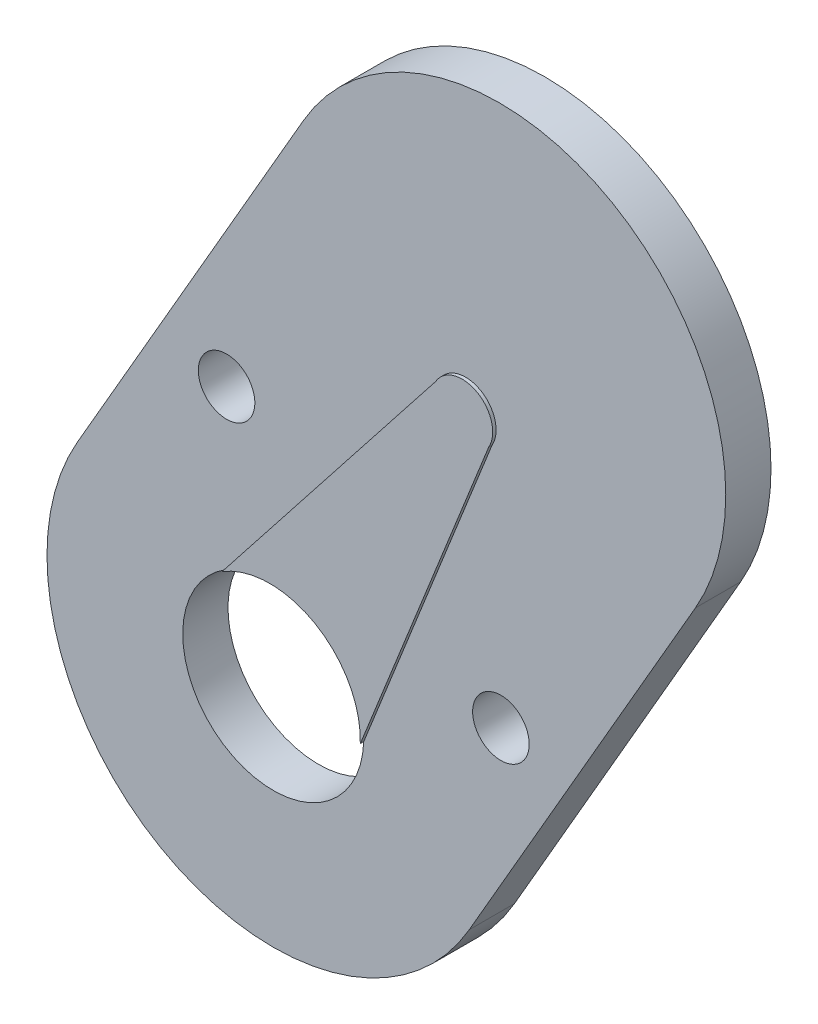
from build123d import *

# Parameters (mm, degrees)
RETAINER_PLATE_2MM_START         = -2
RETAINER_PLATE_2MM_DEPTH         = 2
RETAINER_PLATE_2MM_ROOT_START    = -2
SKETCH_2_R                       = 10
RETAINER_PLATE_2MM_ROOT_DEPTH    = 2
RETAINER_PLATE_2MM_TIP_START     = -2
SKETCH_3_R                       = 10
RETAINER_PLATE_2MM_TIP_DEPTH     = 2
HORN_CONTACT_PAD_0P15_DEPTH      = 0.15
SKETCH_5_R                       = 3.8
HORN_CONTACT_PAD_0P15_ROOT_DEPTH = 0.15
SKETCH_6_R                       = 1.35
HORN_CONTACT_PAD_0P15_TIP_DEPTH  = 0.15
BOSS_CLEARANCE_8_START           = -2.1
SKETCH_7_R                       = 4
BOSS_CLEARANCE_8_DEPTH           = 2.5
M2_CLEARANCE_2P5_PITCH14_START   = -2.1
SKETCH_8_R                       = 1.25
M2_CLEARANCE_2P5_PITCH14_DEPTH   = 2.5


with BuildPart() as part:
    # 草图1 → Retainer_plate_2mm (new body)
    with BuildSketch(Plane.XY.offset(RETAINER_PLATE_2MM_START)):
        Polygon((8.660254038, -5), (18.660254038, 12.320508076), (1.339745962, 22.320508076), (-8.660254038, 5), align=None)
    extrude(amount=RETAINER_PLATE_2MM_DEPTH)

    # 草图2 → Retainer_plate_2mm_root (add)
    with BuildSketch(Plane.XY.offset(RETAINER_PLATE_2MM_ROOT_START)):
        Circle(SKETCH_2_R)
    extrude(amount=RETAINER_PLATE_2MM_ROOT_DEPTH)

    # 草图3 → Retainer_plate_2mm_tip (add)
    with BuildSketch(Plane.XY.offset(RETAINER_PLATE_2MM_TIP_START)):
        with Locations((10, 17.320508076)):
            Circle(SKETCH_3_R)
    extrude(amount=RETAINER_PLATE_2MM_TIP_DEPTH)

    # 草图4 → Horn_contact_pad_0p15 (add)
    with BuildSketch(Plane.XY):
        Polygon((3.290896534, -1.9), (9.669134295, 14.047431864), (7.330865705, 15.397431864), (-3.290896534, 1.9), align=None)
    extrude(amount=HORN_CONTACT_PAD_0P15_DEPTH)

    # 草图5 → Horn_contact_pad_0p15_root (add)
    with BuildSketch(Plane.XY):
        Circle(SKETCH_5_R)
    extrude(amount=HORN_CONTACT_PAD_0P15_ROOT_DEPTH)

    # 草图6 → Horn_contact_pad_0p15_tip (add)
    with BuildSketch(Plane.XY):
        with Locations((8.5, 14.722431864)):
            Circle(SKETCH_6_R)
    extrude(amount=HORN_CONTACT_PAD_0P15_TIP_DEPTH)

    # 草图7 → Boss_clearance_8 (cut)
    with BuildSketch(Plane.XY.offset(BOSS_CLEARANCE_8_START)):
        Circle(SKETCH_7_R)
    extrude(amount=BOSS_CLEARANCE_8_DEPTH, mode=Mode.SUBTRACT)

    # 草图8 → M2_clearance_2p5_pitch14 (cut)
    with BuildSketch(Plane.XY.offset(M2_CLEARANCE_2P5_PITCH14_START)):
        with Locations((10.062177826, 3.42820323)):
            Circle(SKETCH_8_R)
        with Locations((-2.062177826, 10.42820323)):
            Circle(SKETCH_8_R)
    extrude(amount=M2_CLEARANCE_2P5_PITCH14_DEPTH, mode=Mode.SUBTRACT)


solid = part.part
